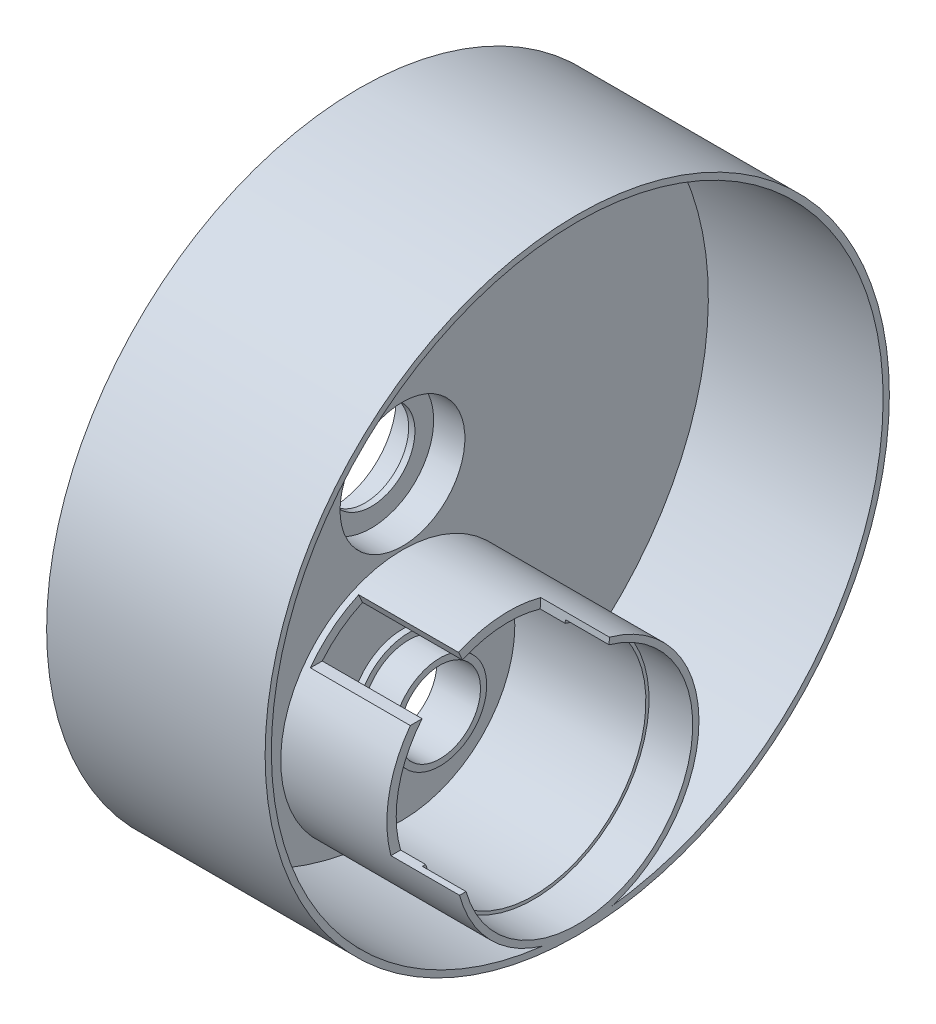
from build123d import *

# Parameters (mm, degrees)
CUT_EXTRUDE_START        = -11
CUT_EXTRUDE_1_DEPTH      = 11
CUT_EXTRUDE_2_DEPTH      = 27
EXTRUDE_START            = -1
SKETCH_4_R               = 50
SKETCH_4_R_2             = 10
SKETCH_4_R_3             = 6.5
EXTRUDE_1_DEPTH          = 1
EXTRUDE_2_DEPTH          = 6
EXTRUDE_2_DEPTH_BACK     = 29
SKETCH_5_R               = 50
SKETCH_5_R_2             = 49
CUT_EXTRUDE_3_REACH      = 100.697
SKETCH_12_R              = 5
M2X0_41_D                = 1.6
PATTERN_CIRCULAR_1_COUNT = 3


with BuildPart() as part:
    # Эскиз1 → Повернуть1 (revolve)
    with BuildSketch(Plane.XY):
        Polygon((-27, 7.5), (-27, 8.5), (-28, 8.5), (-28, 18), (-7, 18), (-7, 18.5), (0, 18.5), (0, 19.5), (-29, 19.5), (-29, 6.5), (-22, 6.5), (-22, 7.5), align=None)
    revolve(axis=Axis((0, 0, 0), (1, 0, 0)))

    # Эскиз2 → Вырез-Вытянуть1 (cut)
    with BuildSketch(Plane(origin=(0, 0, 0), x_dir=(0, 0, -1), z_dir=(1, 0, 0)).offset(CUT_EXTRUDE_START)):
        with BuildLine():
            Line((5.156251293, 18.805931846), (5, 16.248076809))
            ThreePointArc((5, 16.248076809), (-12.02081528, 12.02081528), (-16.248076809, -5))
            Line((-16.248076809, -5), (-18.848076825, -5))
            ThreePointArc((-18.848076825, -5), (-13.731246096, 13.845680938), (5.156251293, 18.805931846))
        make_face()
    extrude(amount=CUT_EXTRUDE_1_DEPTH, mode=Mode.SUBTRACT)

    # Эскиз3 → Вырез-Вытянуть2 (cut)
    with BuildSketch(Plane(origin=(0, 0, 0), x_dir=(0, 0, -1), z_dir=(1, 0, 0))):
        with BuildLine():
            Line((-40, 11.5), (-12.519984026, 11.5))
            ThreePointArc((-12.519984026, 11.5), (-9.954045186, 13.781037132), (-6.982120022, 15.5))
            Line((-6.982120022, 15.5), (-13.240816858, 29.394032278))
            Line((-13.240816858, 29.394032278), (-40, 11.5))
        make_face()
    extrude(amount=-CUT_EXTRUDE_2_DEPTH, mode=Mode.SUBTRACT)

    # Эскиз4 → Бобышка-Вытянуть1 (add)
    with BuildSketch(Plane.ZY.offset(29).offset(EXTRUDE_START)):
        with Locations((0, 30)):
            Circle(SKETCH_4_R)
        with Locations((0, 30)):
            Circle(SKETCH_4_R_2, mode=Mode.SUBTRACT)
        Circle(SKETCH_4_R_3, mode=Mode.SUBTRACT)
    extrude(amount=EXTRUDE_1_DEPTH)

    # Эскиз5 → Бобышка-Вытянуть2 (add, two sides: drawn at the far end of the back side and taken through both)
    with BuildSketch(Plane.ZY.offset(29).offset(-EXTRUDE_2_DEPTH_BACK)):
        with Locations((0, 30)):
            Circle(SKETCH_5_R)
        with Locations((0, 30)):
            Circle(SKETCH_5_R_2, mode=Mode.SUBTRACT)
    extrude(amount=EXTRUDE_2_DEPTH + EXTRUDE_2_DEPTH_BACK)

    # Эскиз9 → Повернуть2 (revolve)
    with BuildSketch(Plane.XY):
        Polygon((-39, 40), (-34, 40), (-34, 37), (-33, 37), (-33, 40), (-29, 40), (-29, 41), (-39, 41), align=None)
    revolve(axis=Axis((-50.347442598, 30, 0), (1, 0, 0)))

    # Эскиз12 → Вырез-Вытянуть3 (cut, up to next)
    with BuildSketch(Plane.ZY.offset(29), mode=Mode.PRIVATE) as cut_extrude_3_sk1:
        with Locations((26.4, 30)):
            Circle(SKETCH_12_R)
    cut_extrude_3_tool1 = extrude(cut_extrude_3_sk1.sketch, amount=-CUT_EXTRUDE_3_REACH, mode=Mode.PRIVATE) & part.part
    add(cut_extrude_3_tool1.solids().sort_by_distance((-29, 30, 26.4))[0], mode=Mode.SUBTRACT)

    # Сверление под метчик M2x0.41 (through all)
    with Locations(Plane.ZY.offset(29)):
        with Locations((26.4, 36.5)):
            m2x0_41 = Hole(M2X0_41_D / 2)

    # Круговой массив1: Сверление под метчик M2x0.41 ×3 about axis
    pattern_circular_1_axis = Axis((0.001, 30, 26.4), (-1, 0, 0))
    for i in range(1, PATTERN_CIRCULAR_1_COUNT):
        add(m2x0_41.rotate(pattern_circular_1_axis, i * 360 / PATTERN_CIRCULAR_1_COUNT), mode=Mode.SUBTRACT)


solid = part.part
